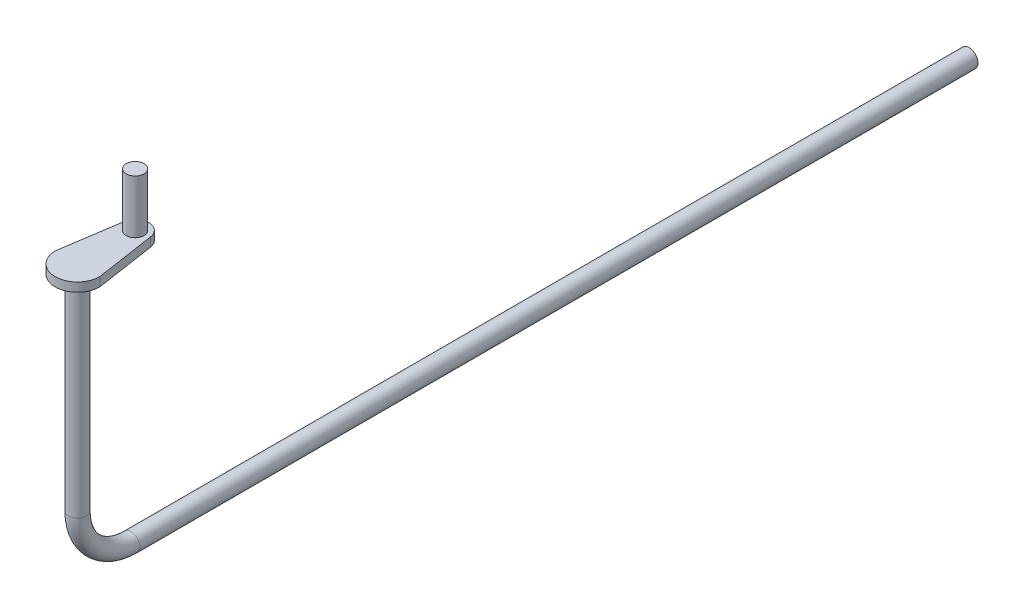
from build123d import *

# Parameters (mm, degrees)
SKETCH1_R           = 10
BOSS_EXTRUDE1_DEPTH = 10
SKETCH2_R           = 10
BOSS_EXTRUDE2_DEPTH = 60
SWEEP1_START        = -1000
SWEEP1_OUTLINE_R    = 10
SWEEP1_DEPTH        = 940
SWEEP1_START_2      = -230.0000001
SWEEP1_2_OUTLINE_R  = 10
SWEEP1_2_DEPTH      = 240.0000001
SWEEP1_3_OUTLINE_R  = 10
SWEEP1_3_ANGLE      = 90


with BuildPart() as part:
    # Sketch1 → Boss-Extrude1 (new body)
    with BuildSketch(Plane(origin=(0, 0, 0), x_dir=(1, 0, 0), z_dir=(0, 1, 0))):
        with BuildLine():
            ThreePointArc((14.831374996, 67.242836537), (0, 80), (-14.831374996, 67.242836537))
            Line((-14.831374996, 67.242836537), (-23.88215206, 7.392077718))
            Line((-23.88215206, 7.392077718), (-25, 0))
            ThreePointArc((-25, 0), (0, -25), (25, 0))
            Line((25, 0), (23.88215206, 7.392077718))
            Line((23.88215206, 7.392077718), (14.831374996, 67.242836537))
        make_face()
        with Locations(Location((0, 0, 0), (0, 0, 270))):
            Circle(SKETCH1_R, mode=Mode.SUBTRACT)
    extrude(amount=BOSS_EXTRUDE1_DEPTH)

    # Sketch2 → Boss-Extrude2 (add)
    with BuildSketch(Plane(origin=(0, 10, 0), x_dir=(1, 0, 0), z_dir=(0, 1, 0))):
        with Locations(Location((0, 64.677844525, 0), (0, 0, 270))):
            Circle(SKETCH2_R)
    extrude(amount=BOSS_EXTRUDE2_DEPTH)

    # Sweep1 2 outline → Sweep1 2 (add)
    with BuildSketch(Plane(origin=(0, 0, 0), x_dir=(1, 0, 0), z_dir=(0, 1, 0)).offset(SWEEP1_START_2)):
        Circle(SWEEP1_2_OUTLINE_R)
    extrude(amount=SWEEP1_2_DEPTH)



with BuildPart() as body_2:
    # Sweep1: read off the stored shape, not the designer's step
    # Sweep1 outline → Sweep1 (new body)
    with BuildSketch(Plane.XY.offset(SWEEP1_START)):
        with Locations((0, -290)):
            Circle(SWEEP1_OUTLINE_R)
    extrude(amount=SWEEP1_DEPTH)


with BuildPart() as part_1:
    add(part.part)

    add(body_2.part)  # Sweep1 3 merges body 2
    # Sweep1 3 outline → Sweep1 3 (revolve)
    with BuildSketch(Plane(origin=(0, -230, -60), x_dir=(0, 0, 1), z_dir=(0, 1, 0))):
        with Locations((60, 0)):
            Circle(SWEEP1_3_OUTLINE_R)
    revolve(axis=Axis((0, -230, -60), (1, 0, 0)), revolution_arc=SWEEP1_3_ANGLE)


solid = part_1.part
